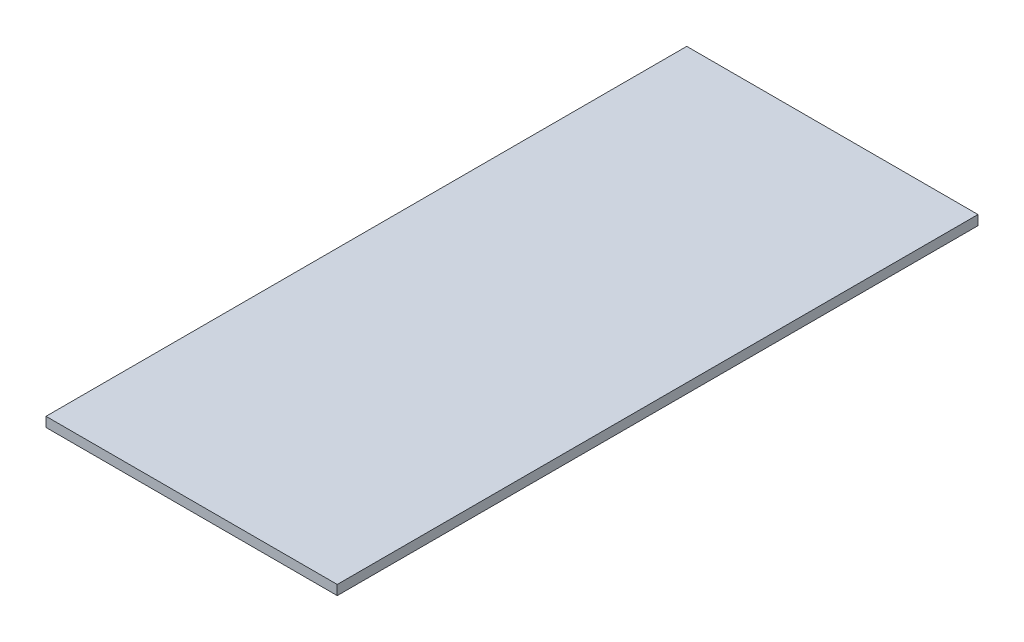
from build123d import *

# Parameters (mm, degrees)
SKETCH1_W           = 300
SKETCH1_H           = 660
BOSS_EXTRUDE1_DEPTH = 10


with BuildPart() as part:
    # Sketch1 → Boss-Extrude1 (new body)
    with BuildSketch(Plane.XZ.offset(-29.143326369)):
        with Locations((-180.300605602, 148.433128803)):
            Rectangle(SKETCH1_W, SKETCH1_H)
    extrude(amount=BOSS_EXTRUDE1_DEPTH)


solid = part.part
